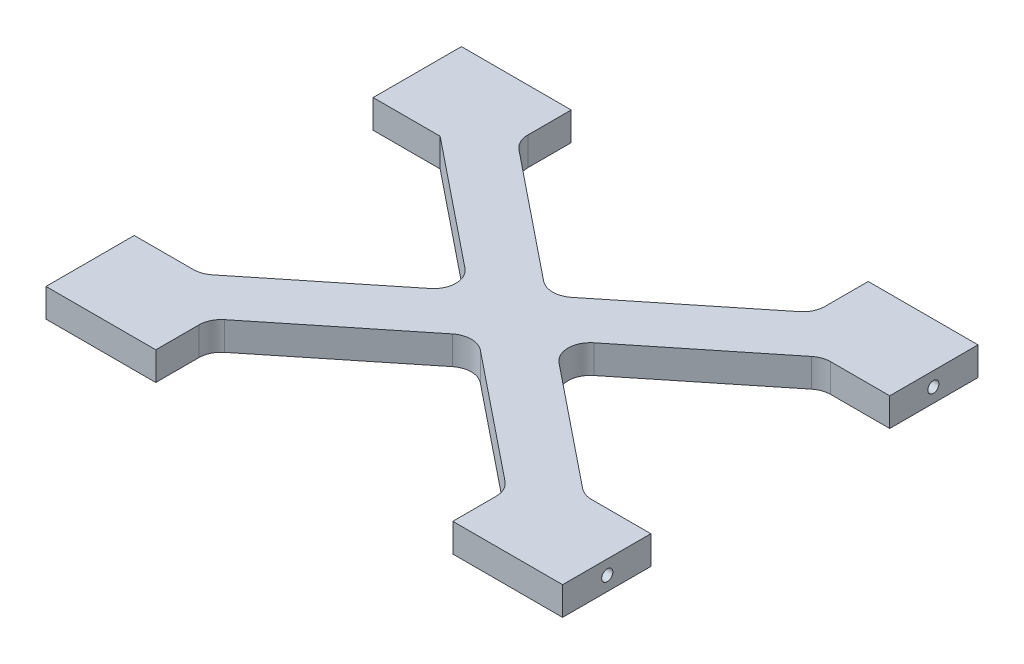
from build123d import *

# Parameters (mm, degrees)
BOSS_EXTRUDE1_DEPTH = 6.35
FILLET1_R           = 5
SKETCH2_R           = 1.25
CUT_EXTRUDE1_DEPTH  = 20


with BuildPart() as part:
    # Sketch1 → Boss-Extrude1 (new body)
    with BuildSketch(Plane(origin=(0, 0, 0), x_dir=(1, 0, 0), z_dir=(0, 1, 0))):
        Polygon((-57.825, 26.738412941), (-42.825, 26.738412941), (-9.574489714, 0), (-42.825, -26.738412941), (-57.825, -26.738412941), (-57.825, -46.5), (-33.250510286, -46.5), (-33.250510286, -34.437743191), (0, -7.69933025), (33.250510286, -34.437743191), (33.250510286, -46.5), (57.825, -46.5), (57.825, -26.738412941), (42.825, -26.738412941), (9.574489714, 0), (42.825, 26.738412941), (57.825, 26.738412941), (57.825, 46.5), (33.250510286, 46.5), (33.250510286, 34.437743191), (0, 7.69933025), (-33.250510286, 34.437743191), (-33.250510286, 46.5), (-57.825, 46.5), align=None)
    extrude(amount=BOSS_EXTRUDE1_DEPTH)

    # Fillet1
    fillet1_edges = [part.edges().sort_by_distance(p)[0] for p in [
        (-33.250510286, 3.175, -34.437743191),
        (33.250510286, 3.175, -34.437743191),
        (42.825, 3.175, -26.738412941),
        (42.825, 3.175, 26.738412941),
        (33.250510286, 3.175, 34.437743191),
        (-33.250510286, 3.175, 34.437743191),
        (-42.825, 3.175, 26.738412941),
        (-9.574489714, 3.175, 0),
        (0, 3.175, -7.69933025),
        (9.574489714, 3.175, 0),
        (0, 3.175, 7.69933025),
    ]]
    fillet(fillet1_edges, radius=FILLET1_R)

    # Sketch2 → Cut-Extrude1 (cut)
    with BuildSketch(Plane(origin=(57.825, 0, 0), x_dir=(0, 0, -1), z_dir=(1, 0, 0))):
        with Locations((36.5, 3.175)):
            Circle(SKETCH2_R)
        with Locations((-36.5, 3.175)):
            Circle(SKETCH2_R)
    cut_extrude1 = extrude(amount=-CUT_EXTRUDE1_DEPTH, mode=Mode.SUBTRACT)

    # Mirror1: Cut-Extrude1 across plane
    add(cut_extrude1.mirror(Plane(origin=(0, 0, 0), x_dir=(0, 0, 1), z_dir=(1, 0, 0))), mode=Mode.SUBTRACT)


solid = part.part
